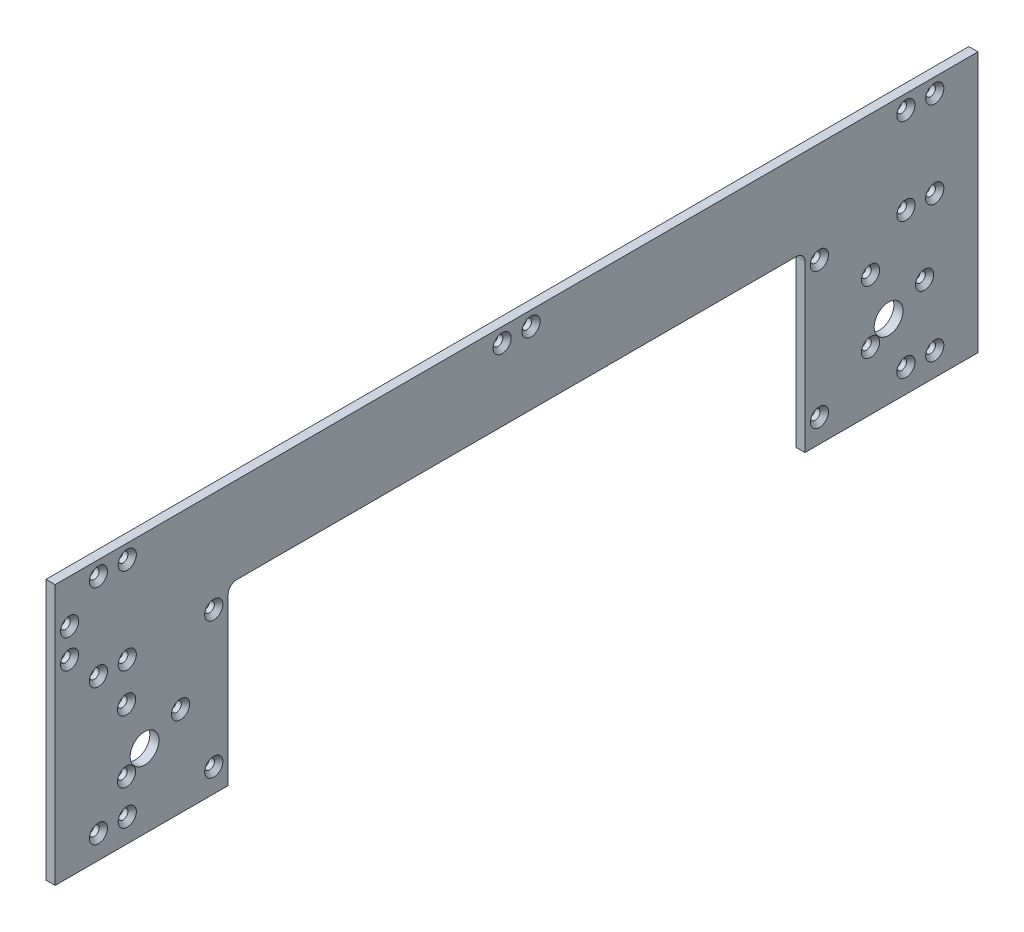
from build123d import *

# Parameters (mm, degrees)
BOSS_EXTRUDE1_DEPTH                             = 3.175
CSK_FOR_M3_FLAT_HEAD_MACHINE_SCREW1_D           = 3.4
CSK_FOR_M3_FLAT_HEAD_MACHINE_SCREW1_CSINK_D     = 6.3
CSK_FOR_M3_FLAT_HEAD_MACHINE_SCREW1_CSINK_ANGLE = 90
SKETCH4_R                                       = 5
CUT_EXTRUDE1_DEPTH                              = 184.774870766
CSK_FOR_M3_FLAT_HEAD_MACHINE_SCREW2_D           = 3.4
CSK_FOR_M3_FLAT_HEAD_MACHINE_SCREW2_CSINK_D     = 6.3
CSK_FOR_M3_FLAT_HEAD_MACHINE_SCREW2_CSINK_ANGLE = 90
CSK_FOR_M3_FLAT_HEAD_MACHINE_SCREW3_D           = 3.4
CSK_FOR_M3_FLAT_HEAD_MACHINE_SCREW3_CSINK_D     = 6.3
CSK_FOR_M3_FLAT_HEAD_MACHINE_SCREW3_CSINK_ANGLE = 90
LPATTERN1_COUNT                                 = 2
LPATTERN1_PITCH                                 = 258


with BuildPart() as part:
    # Sketch1 → Boss-Extrude1 (new body)
    with BuildSketch(Plane(origin=(0, 0, 0), x_dir=(0, 0, -1), z_dir=(1, 0, 0))):
        Polygon((160, 0), (160, 3.175), (160, 47.175), (160, 50.35), (160, 60.35), (160, 90.35), (-160, 90.35), (-160, 60.35), (-160, 50.35), (-160, 47.175), (-160, 3.175), (-160, 0), align=None)
    extrude(amount=BOSS_EXTRUDE1_DEPTH)

    # CSK for M3 Flat Head Machine Screw1 (through all)
    with Locations(Plane(origin=(3.175, 0, 0), x_dir=(0, 0, -1), z_dir=(1, 0, 0))):
        with Locations((-145, 8.175), (-135, 8.175), (-105, 8.175), (-145, 55.35), (-135, 55.35), (-105, 55.35), (-145, 85.35), (-135, 85.35), (-5, 85.35)):
            csk_for_m3_flat_head_machine_screw1 = CounterSinkHole(CSK_FOR_M3_FLAT_HEAD_MACHINE_SCREW1_D / 2, CSK_FOR_M3_FLAT_HEAD_MACHINE_SCREW1_CSINK_D / 2, counter_sink_angle=CSK_FOR_M3_FLAT_HEAD_MACHINE_SCREW1_CSINK_ANGLE)

    # Mirror1: CSK for M3 Flat Head Machine Screw1 across plane
    add(csk_for_m3_flat_head_machine_screw1.mirror(Plane.XY), mode=Mode.SUBTRACT)

    # Sketch4 → Cut-Extrude1 (cut, through all)
    with BuildSketch(Plane(origin=(3.175, 0, 0), x_dir=(0, 0, -1), z_dir=(1, 0, 0))):
        with Locations((-129, 25.675)):
            Circle(SKETCH4_R)
        with Locations((129, 25.675)):
            Circle(SKETCH4_R)
        with BuildLine():
            Line((-100, 57.35), (-100, 0))
            Line((-100, 0), (100, 0))
            Line((100, 0), (100, 57.35))
            ThreePointArc((100, 57.35), (99.121320344, 59.471320344), (97, 60.35))
            Line((97, 60.35), (-97, 60.35))
            ThreePointArc((-97, 60.35), (-99.121320344, 59.471320344), (-100, 57.35))
        make_face()
    extrude(amount=-CUT_EXTRUDE1_DEPTH, mode=Mode.SUBTRACT)

    # CSK for M3 Flat Head Machine Screw2 (through all)
    with Locations(Plane(origin=(3.175, 0, 0), x_dir=(0, 0, -1), z_dir=(1, 0, 0))):
        with Locations((-155, 65.35), (-155, 75.35)):
            CounterSinkHole(CSK_FOR_M3_FLAT_HEAD_MACHINE_SCREW2_D / 2, CSK_FOR_M3_FLAT_HEAD_MACHINE_SCREW2_CSINK_D / 2, counter_sink_angle=CSK_FOR_M3_FLAT_HEAD_MACHINE_SCREW2_CSINK_ANGLE)

    # CSK for M3 Flat Head Machine Screw3 (through all)
    with Locations(Plane(origin=(3.175, 0, 0), x_dir=(0, 0, -1), z_dir=(1, 0, 0))):
        with Locations((-116.5, 31.175), (-135.25, 20.349682453), (-135.25, 42.000317547)):
            csk_for_m3_flat_head_machine_screw3 = CounterSinkHole(CSK_FOR_M3_FLAT_HEAD_MACHINE_SCREW3_D / 2, CSK_FOR_M3_FLAT_HEAD_MACHINE_SCREW3_CSINK_D / 2, counter_sink_angle=CSK_FOR_M3_FLAT_HEAD_MACHINE_SCREW3_CSINK_ANGLE)

    # LPattern1: CSK for M3 Flat Head Machine Screw3 ×2
    with Locations(*[(0, 0, -i * LPATTERN1_PITCH) for i in range(1, LPATTERN1_COUNT)]):
        add(csk_for_m3_flat_head_machine_screw3, mode=Mode.SUBTRACT)


solid = part.part
